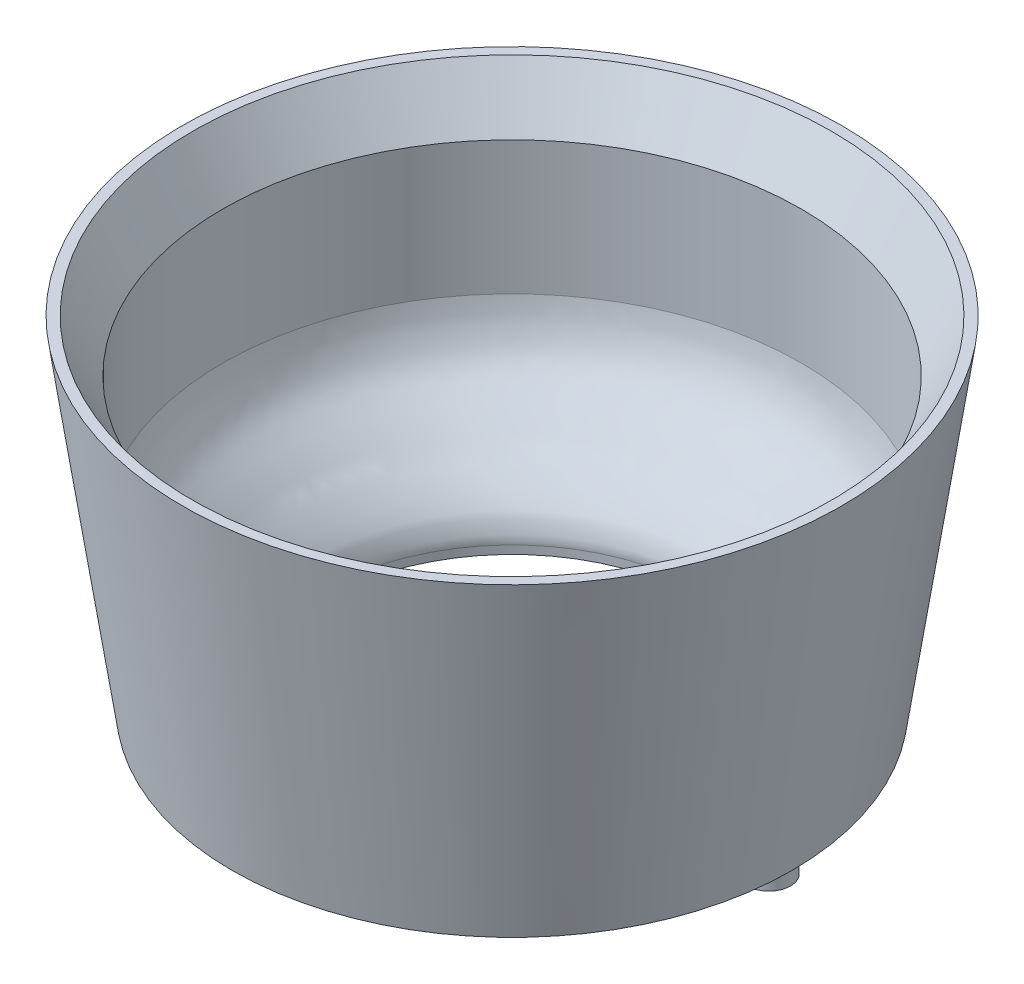
from build123d import *

# Parameters (mm, degrees)
SKETCH4_R           = 3
BOSS_EXTRUDE1_DEPTH = 2
SKETCH9_R           = 1.5
CUT_EXTRUDE1_DEPTH  = 6
SKETCH10_R          = 2
CUT_EXTRUDE2_DEPTH  = 0.5


with BuildPart() as part:
    # Sketch2 → Revolve6 (revolve)
    with BuildSketch(Plane(origin=(0, 0, 0), x_dir=(0, 0, -1), z_dir=(1, 0, 0))):
        with BuildLine():
            Line((26.5077562, 274.996982717), (26.5077562, 273.848618937))
            Line((26.5077562, 273.848618937), (39.220771912, 273.848618937))
            Line((39.220771912, 273.848618937), (46.181267187, 321.561079724))
            Line((46.181267187, 321.561079724), (44.775299462, 321.561079724))
            Line((44.775299462, 321.561079724), (40.547674755, 314.238618937))
            Line((40.547674755, 314.238618937), (40.547674755, 295.540718438))
            add(Edge.make_bspline(
                [(40.547674755, 295.540718438), (40.447740466, 295.012709616), (40.292777353, 293.970757619), (39.930889755, 292.587532753), (39.516186416, 291.581451359), (39.108370782, 290.57804728), (38.439698054, 289.316986818), (37.331416086, 288.032583079), (36.368363881, 287.115418474), (35.630231264, 286.340079673), (35.016472726, 285.762737126), (34.394259795, 285.247169223), (33.635524662, 284.556557999), (32.920361334, 283.771384038), (32.129651901, 282.986073936), (31.485241784, 282.459482323), (30.914997208, 281.963476573), (30.371700346, 281.391298159), (29.782796159, 280.80462685), (29.227584581, 280.262154528), (28.724752618, 279.674853681), (28.180386253, 279.039651715), (27.651838315, 278.470209992), (27.308145935, 277.876839187), (26.995230081, 277.127164256), (26.597952618, 276.164510632), (26.464811583, 275.470548141), (26.5077562, 274.996982717)],
                knots=[0, 0, 0, 0, 0.062544048, 0.125088096, 0.156360121, 0.187632145, 0.250176193, 0.312720241, 0.375264289, 0.406536313, 0.437808337, 0.469080362, 0.500352386, 0.562896434, 0.594168458, 0.625440482, 0.656712506, 0.68798453, 0.719256554, 0.750528579, 0.781800603, 0.813072627, 0.844344651, 0.875616675, 0.906888699, 0.938160723, 1.000704771, 1.000704771, 1.000704771, 1.000704771], degree=3))
        make_face()
    revolve(axis=Axis((0, 5, 0), (0, 1, 0)))

    # Sketch4 → Boss-Extrude1 (add)
    with BuildSketch(Plane.XZ.offset(-273.848618937)):
        with Locations(Location((-31.176914536, 18, 0), (0, 0, 270))):
            Circle(SKETCH4_R)
        with Locations(Location((36, 0, 0), (0, 0, 270))):
            Circle(SKETCH4_R)
    extrude(amount=BOSS_EXTRUDE1_DEPTH)

    # Sketch9 → Cut-Extrude1 (cut)
    with BuildSketch(Plane.XZ.offset(-271.848618937)):
        with Locations(Location((36, 0, 0), (0, 0, 270))):
            Circle(SKETCH9_R)
        with Locations(Location((-31.176914536, 18, 0), (0, 0, 270))):
            Circle(SKETCH9_R)
    extrude(amount=-CUT_EXTRUDE1_DEPTH, mode=Mode.SUBTRACT)

    # Sketch10 → Cut-Extrude2 (cut)
    with BuildSketch(Plane.XZ.offset(-271.848618937)):
        with Locations(Location((36, 0, 0), (0, 0, 270))):
            Circle(SKETCH10_R)
        with Locations(Location((-31.176914536, 18, 0), (0, 0, 270))):
            Circle(SKETCH10_R)
    extrude(amount=-CUT_EXTRUDE2_DEPTH, mode=Mode.SUBTRACT)

    # Chamfer3: read off the stored shape, not the designer's step
    # Chamfer3: loft between two sections, ruled curve by curve
    chamfer3_from = [
        Edge.make_three_point_arc((-31.176914536, 272.348618937, 15.95), (-29.126914536, 272.348618937, 18), (-31.176914536, 272.348618937, 20.05)),
        Edge.make_three_point_arc((-31.176914536, 272.348618937, 20.05), (-33.226914536, 272.348618937, 18), (-31.176914536, 272.348618937, 15.95)),
    ]
    chamfer3_to = [
        Edge.make_three_point_arc((-31.176914536, 271.848618937, 15.45), (-28.626914536, 271.848618937, 18), (-31.176914536, 271.848618937, 20.55)),
        Edge.make_three_point_arc((-31.176914536, 271.848618937, 20.55), (-33.726914536, 271.848618937, 18), (-31.176914536, 271.848618937, 15.45)),
    ]
    chamfer3 = Solid(Shell([*[Face.make_surface_from_curves(chamfer3_from[k], chamfer3_to[k]) for k in range(2)], Face(Wire(chamfer3_from)), Face(Wire(chamfer3_to))]))
    add(chamfer3, mode=Mode.SUBTRACT)

    # Chamfer3 2: loft between two sections, ruled curve by curve
    chamfer3_2_from = [
        Edge.make_three_point_arc((36, 272.348618937, -2.05), (38.05, 272.348618937, 0), (36, 272.348618937, 2.05)),
        Edge.make_three_point_arc((36, 272.348618937, 2.05), (33.95, 272.348618937, 0), (36, 272.348618937, -2.05)),
    ]
    chamfer3_2_to = [
        Edge.make_three_point_arc((36, 271.848618937, -2.55), (38.55, 271.848618937, 0), (36, 271.848618937, 2.55)),
        Edge.make_three_point_arc((36, 271.848618937, 2.55), (33.45, 271.848618937, 0), (36, 271.848618937, -2.55)),
    ]
    chamfer3_2 = Solid(Shell([*[Face.make_surface_from_curves(chamfer3_2_from[k], chamfer3_2_to[k]) for k in range(2)], Face(Wire(chamfer3_2_from)), Face(Wire(chamfer3_2_to))]))
    add(chamfer3_2, mode=Mode.SUBTRACT)


solid = part.part
